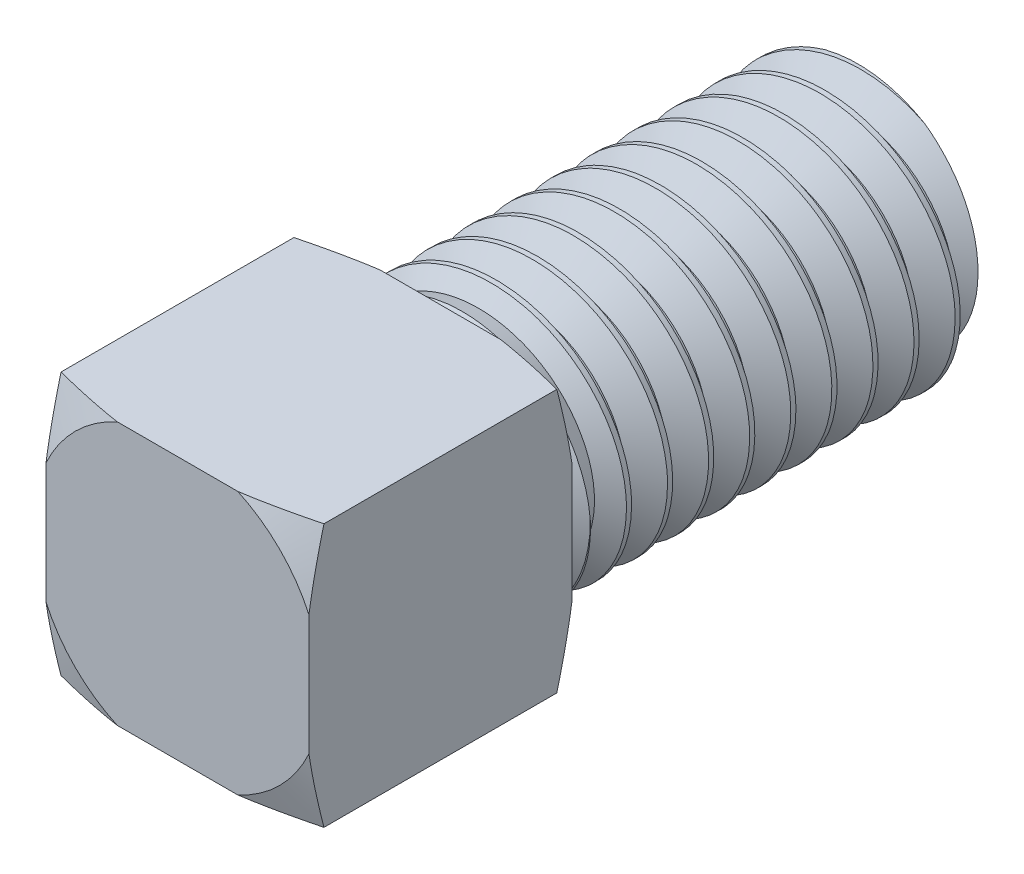
from build123d import *

# Parameters (mm, degrees)
CUT_SWEEP1_PITCH     = 1.25
SKETCH23_W           = 8
SKETCH23_H           = 8
EXTRUDE1_DEPTH       = 8
SKETCH25_OUTSIDE_W   = 206.45
SKETCH25_OUTSIDE_H   = 206.45
SKETCH25_OUTSIDE_R   = 4.4
CUT_EXTRUDE1_DEPTH   = 34.481338112
CUT_EXTRUDE1_DRAFT   = -70
CUT_EXTRUDE2_START   = -8
SKETCH25_2_OUTSIDE_W = 250.41
SKETCH25_2_OUTSIDE_H = 250.41
SKETCH25_2_OUTSIDE_R = 4.4
CUT_EXTRUDE2_DEPTH   = 42.481338112
CUT_EXTRUDE2_DRAFT   = 70
SKETCH28_R           = 3.733333333
BOSS_EXTRUDE1_DEPTH  = 12.7
BOSS_EXTRUDE1_TAPER  = 15
SKETCH30_W           = 12.841472846
SKETCH30_H           = 11.329629548
CUT_EXTRUDE3_DEPTH   = 12.3


with BuildPart() as part:
    # Sketch22 → Revolve1 (revolve)
    with BuildSketch(Plane(origin=(0, 0, 0), x_dir=(0, 0, -1), z_dir=(1, 0, 0))):
        Polygon((-12.5, 0), (-12.5, 3.2), (-11.939833969, 4), (9, 4), (10.25, 2.75), (12.5, 2.75), (12.5, 0), align=None)
    revolve(axis=Axis((0, 0, -13), (0, 0, 1)))

    # Cut-Sweep1: the profile of Sketch6 profile screwed along a right-hand helix of 21 turns, 8 arcs to a turn; built about Z, then put on its axis
    cut_sweep1_z = Axis((0, 0, 0), (0, 0, 1))
    cut_sweep1_corners = [(3.188101184, 0, -0.625), (3.188101184, 0, -0.46875), (4.0003, 0, 0.000173205), (4.0003, 0, -1.093923205)]
    with BuildLine(mode=Mode.PRIVATE) as cut_sweep1_profile:
        Line(cut_sweep1_corners[0], cut_sweep1_corners[1])
        Line(cut_sweep1_corners[1], cut_sweep1_corners[2])
        Line(cut_sweep1_corners[2], cut_sweep1_corners[3])
        Line(cut_sweep1_corners[3], cut_sweep1_corners[0])
    cut_sweep1_cap = Face(cut_sweep1_profile.wire())
    cut_sweep1_turn_angles = [0, 22.5, 45, 67.5, 90, 112.5, 135, 157.5, 180, 202.5, 225, 247.5, 270, 292.5, 315, 337.5, 360]
    cut_sweep1_turn_weights = [1, 0.9238795325112867, 1, 0.9238795325112867, 1, 0.9238795325112867, 1, 0.9238795325112867, 1, 0.9238795325112867, 1, 0.9238795325112867, 1, 0.9238795325112867, 1, 0.9238795325112867, 1]
    cut_sweep1_turn_rails = [Edge.make_bspline([Vector(p[0], p[1], 0).rotate(cut_sweep1_z, cut_sweep1_turn_angles[k]) / cut_sweep1_turn_weights[k] + Vector(0, 0, p[2] + CUT_SWEEP1_PITCH * cut_sweep1_turn_angles[k] / 360) for k in range(17)], [0, 0, 0, 1, 1, 2, 2, 3, 3, 4, 4, 5, 5, 6, 6, 7, 7, 8, 8, 8], 2, cut_sweep1_turn_weights) for p in cut_sweep1_corners]
    cut_sweep1_turn_sides = [Face.make_surface_from_curves(cut_sweep1_turn_rails[p[0]], cut_sweep1_turn_rails[p[1]]) for p in [(0, 1), (1, 2), (2, 3), (3, 0)]]
    cut_sweep1 = Plane(origin=(0, 0, -10.25), x_dir=(0, 1, 0), z_dir=(0, 0, 1)) * Solid(Shell([*[p.moved(Location((0, 0, CUT_SWEEP1_PITCH * i))) for i in range(21) for p in cut_sweep1_turn_sides], cut_sweep1_cap, cut_sweep1_cap.rotate(cut_sweep1_z, 7560).moved(Location((0, 0, CUT_SWEEP1_PITCH * 7560 / 360)))]))
    add(cut_sweep1, mode=Mode.SUBTRACT)

    # Sketch23 → Extrude1 (add)
    with BuildSketch(Plane.XY.offset(12.5)):
        Rectangle(SKETCH23_W, SKETCH23_H)
    extrude(amount=EXTRUDE1_DEPTH)


with BuildPart() as cut_extrude1_tool:
    # Sketch25 outside → Cut-Extrude1 (with draft: the straight prism first)
    with BuildSketch(Plane.XY.offset(20.5)):
        Rectangle(SKETCH25_OUTSIDE_W, SKETCH25_OUTSIDE_H)
        Circle(SKETCH25_OUTSIDE_R, mode=Mode.SUBTRACT)
    extrude(amount=-CUT_EXTRUDE1_DEPTH)
    # Cut-Extrude1: the draft: its side faces are tilted about the plane it starts from
    cut_extrude1_sides = [cut_extrude1_tool.faces().sort_by_distance(p)[0] for p in [
        (0, -103.225, 3.259330944),
        (103.225, 0, 3.259330944),
        (0, 103.225, 3.259330944),
        (-103.225, 0, 3.259330944),
        (-4.4, 0, 3.259330944),
    ]]
    draft(cut_extrude1_sides, Plane.XY.offset(20.5), CUT_EXTRUDE1_DRAFT)


with BuildPart() as part_1:
    add(part.part)

    # Cut-Extrude1: cut by cut_extrude1_tool
    add(cut_extrude1_tool.part, mode=Mode.SUBTRACT)


with BuildPart() as cut_extrude2_tool:
    # Sketch25<2> outside → Cut-Extrude2 (with draft: the straight prism first)
    with BuildSketch(Plane.XY.offset(20.5).offset(CUT_EXTRUDE2_START)):
        Rectangle(SKETCH25_2_OUTSIDE_W, SKETCH25_2_OUTSIDE_H)
        Circle(SKETCH25_2_OUTSIDE_R, mode=Mode.SUBTRACT)
    extrude(amount=CUT_EXTRUDE2_DEPTH)
    # Cut-Extrude2: the draft: its side faces are tilted about the plane it starts from
    cut_extrude2_sides = [cut_extrude2_tool.faces().sort_by_distance(p)[0] for p in [
        (0, -125.205, 33.740669056),
        (125.205, 0, 33.740669056),
        (0, 125.205, 33.740669056),
        (-125.205, 0, 33.740669056),
        (-4.4, 0, 33.740669056),
    ]]
    draft(cut_extrude2_sides, Plane.XY.offset(20.5).offset(CUT_EXTRUDE2_START), CUT_EXTRUDE2_DRAFT)


with BuildPart() as part_2:
    add(part_1.part)

    # Cut-Extrude2: cut by cut_extrude2_tool
    add(cut_extrude2_tool.part, mode=Mode.SUBTRACT)

    # Sketch28 → Boss-Extrude1 (add)
    with BuildSketch(Plane(origin=(0, 0, 12.5), x_dir=(-1, 0, 0), z_dir=(0, 0, -1))):
        Circle(SKETCH28_R)
    extrude(amount=BOSS_EXTRUDE1_DEPTH, taper=BOSS_EXTRUDE1_TAPER)

    # Sketch30 → Cut-Extrude3 (cut)
    with BuildSketch(Plane(origin=(0, 0, -12.5), x_dir=(-1, 0, 0), z_dir=(0, 0, -1))):
        Rectangle(SKETCH30_W, SKETCH30_H)
    extrude(amount=-CUT_EXTRUDE3_DEPTH, mode=Mode.SUBTRACT)


solid = part_2.part
